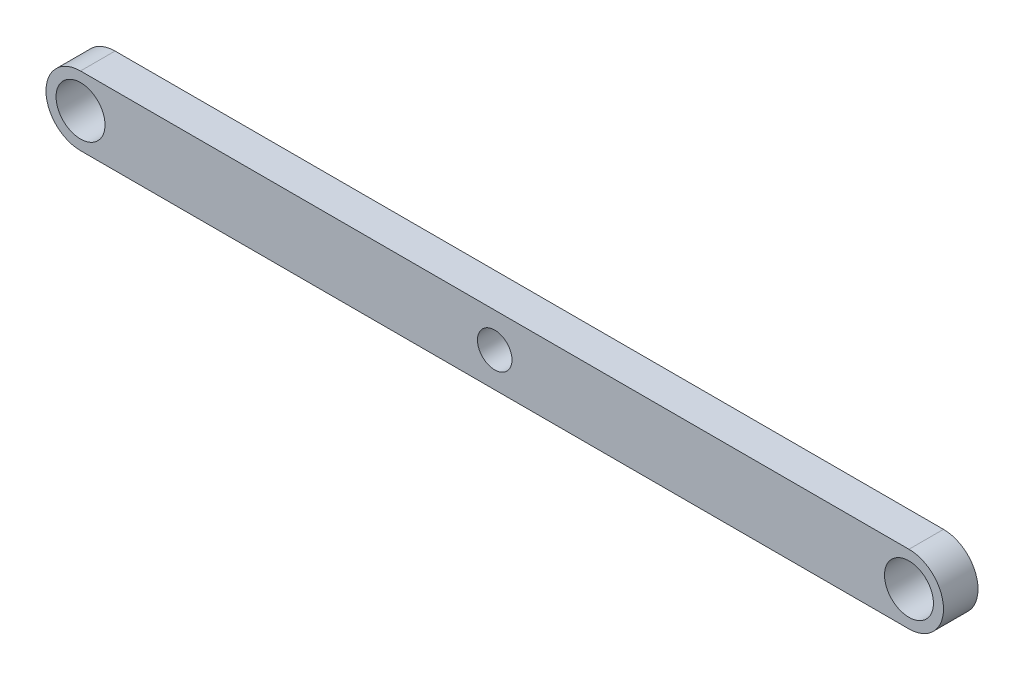
from build123d import *

# Parameters (mm, degrees)
SKETCH1_R           = 4.5
SKETCH1_R_2         = 3.175
BOSS_EXTRUDE1_DEPTH = 6.35


with BuildPart() as part:
    # Sketch1 → Boss-Extrude1 (new body)
    with BuildSketch(Plane.XY):
        with BuildLine():
            Line((76.2, 6.35), (-76.2, 6.35))
            ThreePointArc((-76.2, 6.35), (-82.55, 0), (-76.2, -6.35))
            Line((-76.2, -6.35), (76.2, -6.35))
            ThreePointArc((76.2, -6.35), (82.55, 0), (76.2, 6.35))
        make_face()
        with Locations((-76.2, 0)):
            Circle(SKETCH1_R, mode=Mode.SUBTRACT)
        Circle(SKETCH1_R_2, mode=Mode.SUBTRACT)
        with Locations((76.2, 0)):
            Circle(SKETCH1_R, mode=Mode.SUBTRACT)
    extrude(amount=BOSS_EXTRUDE1_DEPTH)


solid = part.part
